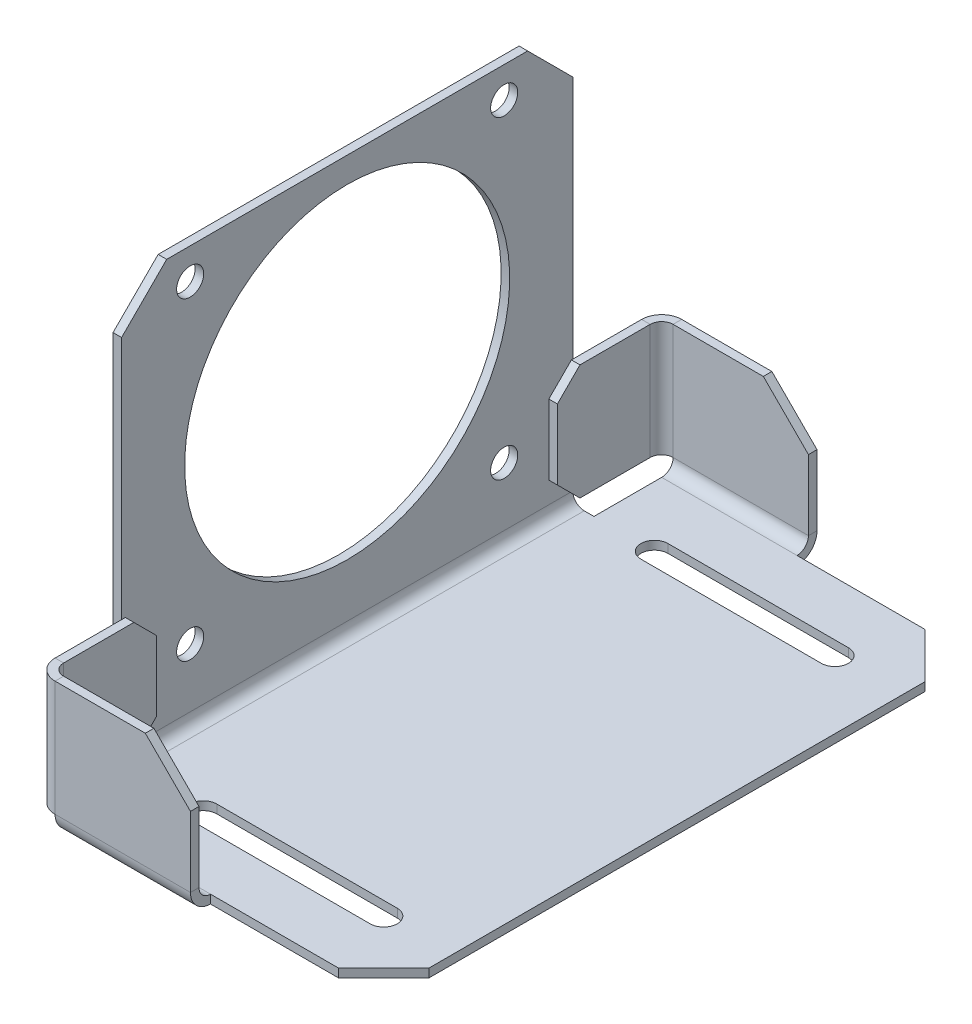
from build123d import *

# Parameters (mm, degrees)
SKETCH1_W                     = 75
SKETCH1_H                     = 130
BASE_FLANGE1_DEPTH            = 1.89738
EDGE_FLANGE1_STRIP_W          = 12.66952
EDGE_FLANGE1_STRIP_H          = 1.89738
EDGE_FLANGE1_STRIP_CUT_DEPTH  = 100
EDGE_FLANGE1_RELIEF_W         = 13.61821
EDGE_FLANGE1_RELIEF_H         = 0.94869
EDGE_FLANGE1_RELIEF_CUT_DEPTH = 1.89738
EDGE_FLANGE1_DEPTH            = 100
SKETCH18_R                    = 3
SKETCH18_R_2                  = 36.022471604
CUT_EXTRUDE1_DEPTH            = 10
BREAK_CORNER1_DEPTH           = 1.89738
BREAK_CORNER2_START           = -1.89738
BREAK_CORNER2_DEPTH           = 1.89738
CUT_EXTRUDE2_DEPTH            = 10
EDGE_FLANGE2_DEPTH            = 30
EDGE_FLANGE3_DEPTH            = 25.56262
EDGE_FLANGE4_DEPTH            = 30
EDGE_FLANGE5_DEPTH            = 25.56262
BREAK_CORNER3_START           = 38.678740931
BREAK_CORNER3_OUTLINE_W       = 18
BREAK_CORNER3_OUTLINE_H       = 1.89738
BREAK_CORNER3_DEPTH           = 7.071067812
BREAK_CORNER4_START           = 2.16
BREAK_CORNER4_DEPTH           = 1.89738
SKETCH32_W                    = 6.59738
SKETCH32_H                    = 15
CUT_EXTRUDE3_DEPTH            = 10


# Read off the part's stored shape, not the designer's step: Break-Corner1, Break-Corner2, Break-Corner3, Break-Corner4
# Sheet-metal steps are written as plain solids
with BuildPart() as part:
    # Sketch1 → Base-Flange1 (new body)
    with BuildSketch(Plane(origin=(0, 0, 0), x_dir=(1, 0, 0), z_dir=(0, 1, 0))):
        with Locations((37.5, 65)):
            Rectangle(SKETCH1_W, SKETCH1_H)
    extrude(amount=-BASE_FLANGE1_DEPTH)

    # Edge-Flange1 strip (across the edge) → Edge-Flange1 strip cut (cut)
    with BuildSketch(Plane.XY.offset(-115)):
        with Locations((-1.89738, -0.94869)):
            Rectangle(EDGE_FLANGE1_STRIP_W, EDGE_FLANGE1_STRIP_H)
    extrude(amount=EDGE_FLANGE1_STRIP_CUT_DEPTH, mode=Mode.SUBTRACT)

    # Edge-Flange1 relief (on the sheet) → Edge-Flange1 relief cut (cut)
    with BuildSketch(Plane(origin=(4.43738, 0, -115), x_dir=(1, 0, 0), z_dir=(0, 1, 0))):
        with Locations((-5.860415, 0.474345)):
            Rectangle(EDGE_FLANGE1_RELIEF_W, EDGE_FLANGE1_RELIEF_H)
        with Locations((-5.860415, -100.474345)):
            Rectangle(EDGE_FLANGE1_RELIEF_W, EDGE_FLANGE1_RELIEF_H)
    extrude(amount=-EDGE_FLANGE1_RELIEF_CUT_DEPTH, mode=Mode.SUBTRACT)

    # Edge-Flange1 section (across the edge) → Edge-Flange1 (add)
    with BuildSketch(Plane.XY.offset(-115)):
        with BuildLine():
            Line((0, 2.54), (0, 92))
            Line((0, 92), (1.89738, 92))
            Line((1.89738, 92), (1.89738, 2.54))
            ThreePointArc((1.89738, 2.54), (2.641328776, 0.743948776), (4.43738, 0))
            Line((4.43738, 0), (4.43738, -1.89738))
            ThreePointArc((4.43738, -1.89738), (1.299678511, -0.597701489), (0, 2.54))
        make_face()
    extrude(amount=EDGE_FLANGE1_DEPTH)

    # Sketch18 → Cut-Extrude1 (cut)
    with BuildSketch(Plane.ZY):
        with Locations(Location((-99.8, 85.14762, 0), (0, 0, 270))):
            Circle(SKETCH18_R)
        with Locations(Location((-30.2, 85.14762, 0), (0, 0, 270))):
            Circle(SKETCH18_R)
        with Locations(Location((-30.2, 15.54762, 0), (0, 0, 270))):
            Circle(SKETCH18_R)
        with Locations(Location((-99.8, 15.54762, 0), (0, 0, 270))):
            Circle(SKETCH18_R)
        with Locations(Location((-65, 50.34762, 0), (0, 0, 270))):
            Circle(SKETCH18_R_2)
    extrude(amount=-CUT_EXTRUDE1_DEPTH, mode=Mode.SUBTRACT)

    # Break-Corner1 outline → Break-Corner1 (cut)
    with BuildSketch(Plane.YZ):
        Polygon((92, -15), (82, -15), (92, -25), align=None)
        Polygon((92, -115), (92, -105), (82, -115), align=None)
    extrude(amount=BREAK_CORNER1_DEPTH, mode=Mode.SUBTRACT)

    # Break-Corner2 outline → Break-Corner2 (cut)
    with BuildSketch(Plane(origin=(0, 0, 0), x_dir=(1, 0, 0), z_dir=(0, 1, 0)).offset(BREAK_CORNER2_START)):
        Polygon((75, 130), (65, 130), (75, 120), align=None)
        Polygon((75, 0), (75, 10), (65, 0), align=None)
    extrude(amount=BREAK_CORNER2_DEPTH, mode=Mode.SUBTRACT)

    # Sketch19 → Cut-Extrude2 (cut)
    with BuildSketch(Plane(origin=(0, 0, 0), x_dir=(1, 0, 0), z_dir=(0, 1, 0))):
        with BuildLine():
            Line((60, 112), (20, 112))
            ThreePointArc((20, 112), (17, 115), (20, 118))
            Line((20, 118), (60, 118))
            ThreePointArc((60, 118), (63, 115), (60, 112))
        make_face()
        with BuildLine():
            Line((60, 12), (20, 12))
            ThreePointArc((20, 12), (17, 15), (20, 18))
            Line((20, 18), (60, 18))
            ThreePointArc((60, 18), (63, 15), (60, 12))
        make_face()
    extrude(amount=-CUT_EXTRUDE2_DEPTH, mode=Mode.SUBTRACT)

    # Edge-Flange2 section (across the edge) → Edge-Flange2 (add)
    with BuildSketch(Plane(origin=(6.59738, 0, 2.54), x_dir=(0, 0, -1), z_dir=(1, 0, 0))):
        with BuildLine():
            Line((-1.89738, 2.54), (-1.89738, 28.10262))
            Line((-1.89738, 28.10262), (0, 28.10262))
            Line((0, 28.10262), (0, 2.54))
            ThreePointArc((0, 2.54), (0.743948776, 0.743948776), (2.54, 0))
            Line((2.54, 0), (2.54, -1.89738))
            ThreePointArc((2.54, -1.89738), (-0.597701489, -0.597701489), (-1.89738, 2.54))
        make_face()
    extrude(amount=EDGE_FLANGE2_DEPTH)

    # Edge-Flange3 section (across the edge) → Edge-Flange3 (add)
    with BuildSketch(Plane(origin=(4.05738, 2.54, 2.54), x_dir=(1, 0, 0), z_dir=(0, 1, 0))):
        with BuildLine():
            Line((-1.89738, 2.54), (-1.89738, 23.10262))
            Line((-1.89738, 23.10262), (0, 23.10262))
            Line((0, 23.10262), (0, 2.54))
            ThreePointArc((0, 2.54), (0.743948776, 0.743948776), (2.54, 0))
            Line((2.54, 0), (2.54, -1.89738))
            ThreePointArc((2.54, -1.89738), (-0.597701489, -0.597701489), (-1.89738, 2.54))
        make_face()
    extrude(amount=EDGE_FLANGE3_DEPTH)

    # Edge-Flange4 section (across the edge) → Edge-Flange4 (add)
    with BuildSketch(Plane(origin=(36.59738, 0, -132.54), x_dir=(0, 0, 1), z_dir=(-1, 0, 0))):
        with BuildLine():
            Line((-1.89738, 2.54), (-1.89738, 28.10262))
            Line((-1.89738, 28.10262), (0, 28.10262))
            Line((0, 28.10262), (0, 2.54))
            ThreePointArc((0, 2.54), (0.743948776, 0.743948776), (2.54, 0))
            Line((2.54, 0), (2.54, -1.89738))
            ThreePointArc((2.54, -1.89738), (-0.597701489, -0.597701489), (-1.89738, 2.54))
        make_face()
    extrude(amount=EDGE_FLANGE4_DEPTH)

    # Edge-Flange5 section (across the edge) → Edge-Flange5 (add)
    with BuildSketch(Plane(origin=(4.05738, 28.10262, -132.54), x_dir=(1, 0, 0), z_dir=(0, -1, 0))):
        with BuildLine():
            Line((-1.89738, 2.54), (-1.89738, 23.10262))
            Line((-1.89738, 23.10262), (0, 23.10262))
            Line((0, 23.10262), (0, 2.54))
            ThreePointArc((0, 2.54), (0.743948776, 0.743948776), (2.54, 0))
            Line((2.54, 0), (2.54, -1.89738))
            ThreePointArc((2.54, -1.89738), (-0.597701489, -0.597701489), (-1.89738, 2.54))
        make_face()
    extrude(amount=EDGE_FLANGE5_DEPTH)

    # Break-Corner3 outline → Break-Corner3 (cut)
    with BuildSketch(Plane(origin=(0, 0, 0), x_dir=(0.707106781186548, -0.707106781186547, 0), z_dir=(0.707106781186547, 0.707106781186548, 0)).offset(BREAK_CORNER3_START)):
        with Locations((6, -3.48869)):
            Rectangle(BREAK_CORNER3_OUTLINE_W, BREAK_CORNER3_OUTLINE_H)
        with Locations((6, 133.48869)):
            Rectangle(BREAK_CORNER3_OUTLINE_W, BREAK_CORNER3_OUTLINE_H)
    extrude(amount=BREAK_CORNER3_DEPTH, mode=Mode.SUBTRACT)

    # Break-Corner4 outline → Break-Corner4 (cut)
    with BuildSketch(Plane.YZ.offset(BREAK_CORNER4_START)):
        Polygon((2.54, -20.56262), (7.54, -20.56262), (2.54, -15.56262), align=None)
        Polygon((28.10262, -15.56262), (23.10262, -20.56262), (28.10262, -20.56262), align=None)
        Polygon((28.10262, -109.43738), (23.10262, -109.43738), (28.10262, -114.43738), align=None)
        Polygon((2.54, -114.43738), (7.54, -109.43738), (2.54, -109.43738), align=None)
    extrude(amount=BREAK_CORNER4_DEPTH, mode=Mode.SUBTRACT)

    # Sketch32 → Cut-Extrude3 (cut)
    with BuildSketch(Plane(origin=(0, 0, 0), x_dir=(1, 0, 0), z_dir=(0, 1, 0))):
        with Locations((3.29869, 122.5)):
            Rectangle(SKETCH32_W, SKETCH32_H)
        with Locations((3.29869, 7.5)):
            Rectangle(SKETCH32_W, SKETCH32_H)
    extrude(amount=-CUT_EXTRUDE3_DEPTH, mode=Mode.SUBTRACT)


solid = part.part
